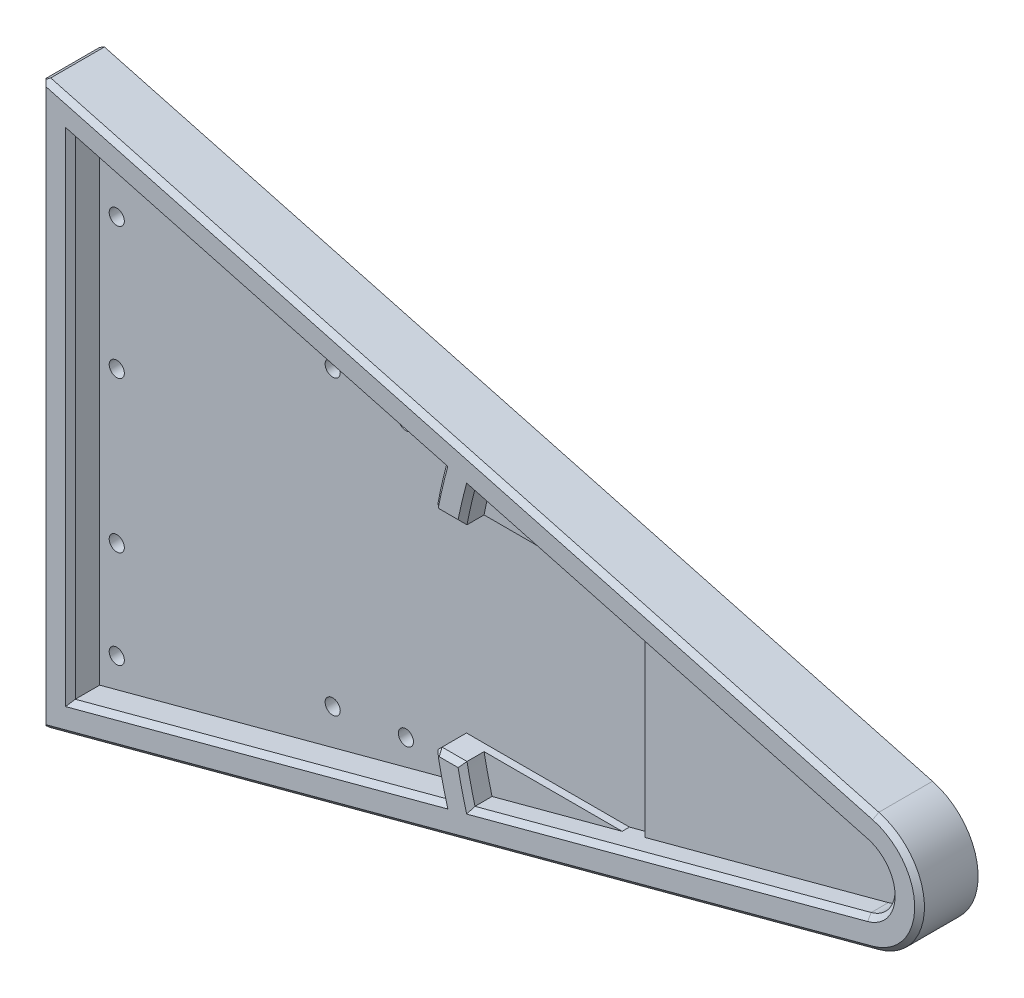
from build123d import *
from OCP.BRepFilletAPI import BRepFilletAPI_MakeChamfer

# Parameters (mm, degrees)
BOSS_EXTRUDE1_DEPTH     = 6
BOSS_EXTRUDE2_START     = 6
BOSS_EXTRUDE2_DEPTH     = 6
BOSS_EXTRUDE3_DEPTH     = 1.5
CUT_EXTRUDE3_DEPTH      = 6
CHAMFER1_SIZE           = 0.858848527
CHAMFER1_SIZE_2         = 1
CHAMFER2_SIZE           = 1
CHAMFER3_SIZE           = 1
CHAMFER3_SIZE2          = 0.816496581
CUT_EXTRUDE4_DEPTH      = 3
CHAMFER4_SIZE           = 1
CUT_EXTRUDE5_DEPTH      = 178.282114668
CUT_EXTRUDE5_DEPTH_BACK = 178.282114668
SKETCH8_R               = 1.55


with BuildPart() as part:
    # Sketch3 → Boss-Extrude1 (new body)
    with BuildSketch(Plane.XY):
        with BuildLine():
            Line((3.263957589, 12.181255556), (-167.389036276, 57.907587448))
            Line((-167.389036276, 57.907587448), (-167.389036276, -57.907587448))
            Line((-167.389036276, -57.907587448), (-83.597968128, -35.455838404))
            Line((-83.597968128, -35.455838404), (3.263957589, -12.181255556))
            ThreePointArc((3.263957589, -12.181255556), (12.610963724, 0), (3.263957589, 12.181255556))
        make_face()
    extrude(amount=BOSS_EXTRUDE1_DEPTH)

    # Sketch3<3> → Boss-Extrude2 (add)
    with BuildSketch(Plane.XY.offset(BOSS_EXTRUDE2_START)):
        with BuildLine():
            ThreePointArc((3.263957589, -12.181255556), (12.610963724, 0), (3.263957589, 12.181255556))
            Line((3.263957589, 12.181255556), (-167.389036276, 57.907587448))
            Line((-167.389036276, 57.907587448), (-167.389036276, -57.907587448))
            Line((-167.389036276, -57.907587448), (-83.597968128, -35.455838404))
            Line((-83.597968128, -35.455838404), (3.263957589, -12.181255556))
        make_face()
        with BuildLine():
            Line((1.711043318, -6.385700598), (-79.486479098, -28.142511157))
            ThreePointArc((-79.486479098, -28.142511157), (-83.143036276, 0), (-79.486479098, 28.142511157))
            Line((-79.486479098, 28.142511157), (1.711043318, 6.385700598))
            ThreePointArc((1.711043318, 6.385700598), (6.610963724, 0), (1.711043318, -6.385700598))
        make_face(mode=Mode.SUBTRACT)
        with BuildLine():
            Line((-85.282065581, -29.695433875), (-161.389036276, -50.088235211))
            Line((-161.389036276, -50.088235211), (-161.389036276, 50.088235211))
            Line((-161.389036276, 50.088235211), (-85.282065581, 29.695433875))
            ThreePointArc((-85.282065581, 29.695433875), (-89.143036276, 0), (-85.282065581, -29.695433875))
        make_face(mode=Mode.SUBTRACT)
    extrude(amount=BOSS_EXTRUDE2_DEPTH)

    # Sketch4 → Boss-Extrude3 (add)
    with BuildSketch(Plane.XY.offset(6)):
        with BuildLine():
            ThreePointArc((-79.486479098, 28.142511157), (-80.363791639, 24.584864194), (-81.12226241, 21))
            Line((-81.12226241, 21), (-52.830264568, 21))
            Line((-52.830264568, 21), (-79.486479098, 28.142511157))
        make_face()
        with BuildLine():
            Line((-79.486479098, -28.142511157), (-52.830264568, -21))
            Line((-52.830264568, -21), (-81.12226241, -21))
            ThreePointArc((-81.12226241, -21), (-80.363791639, -24.584864194), (-79.486479098, -28.142511157))
        make_face()
        with BuildLine():
            Line((-48.09821376, 19.732050808), (-48.09821376, -19.732050808))
            Line((-48.09821376, -19.732050808), (1.711043318, -6.385700598))
            ThreePointArc((1.711043318, -6.385700598), (6.610963724, 0), (1.711043318, 6.385700598))
            Line((1.711043318, 6.385700598), (-48.09821376, 19.732050808))
        make_face()
    extrude(amount=BOSS_EXTRUDE3_DEPTH)

    # Sketch5 → Cut-Extrude3 (cut)
    with BuildSketch(Plane.XY.offset(6)):
        with BuildLine():
            Line((-81.12226241, 21), (-87.228470489, 21))
            ThreePointArc((-87.228470489, 21), (-89.143036276, 0), (-87.228470489, -21))
            Line((-87.228470489, -21), (-81.12226241, -21))
            ThreePointArc((-81.12226241, -21), (-83.143036276, 0), (-81.12226241, 21))
        make_face()
    extrude(amount=CUT_EXTRUDE3_DEPTH, mode=Mode.SUBTRACT)

    # Chamfer1
    # the kernel refuses this chamfer: 1, 0.858848527 mm, written as the material it takes off along each edge
    with BuildSketch(Plane(origin=(-87.228470489, 21, 6), x_dir=(0.1850514416549976, 0.9827288354075131, 0), z_dir=(0, 0, 1))) as chamfer1_piece_1:
        with BuildLine():
            Line((0.995740125, 0), (CHAMFER1_SIZE * 0.185051441724, -CHAMFER1_SIZE * 0.982728835776))
            Line((CHAMFER1_SIZE * 0.185051441724, -CHAMFER1_SIZE * 0.982728835776), (0, 0))
            ThreePointArc((0, 0), (0.511949844, 0.001066408), (0.995740125, 0))
        make_face()
    extrude(amount=8.560742024, mode=Mode.SUBTRACT)
    with BuildSketch(Plane(origin=(-87.228470489, -21, 6), x_dir=(1, 0, 0), z_dir=(0, 0, 1))) as chamfer1_piece_2:
        with BuildLine():
            Line((CHAMFER1_SIZE_2, 0), (0.158025015, -0.841974985))
            ThreePointArc((0.158025015, -0.841974985), (0.080319075, -0.432228603), (0, 0))
            Line((0, 0), (CHAMFER1_SIZE_2, 0))
        make_face()
    extrude(amount=8.571682988, mode=Mode.SUBTRACT)

    # Chamfer2
    chamfer2_edges = [part.edges().sort_by_distance(p)[0] for p in [
        (-86.244364999, -25.784214234, 12),
        (-83.67536645, -21, 12),
        (-86.706914653, 21.489271267, 12),
        (-86.649457982, -21.420987493, 12),
        (-82.062539343, -35.044421502, 12),
        (12.610963724, 0, 12),
        (-161.389036276, 0, 12),
        (-86.228906055, 25.852006602, 12),
        (-123.335550929, -39.891834543, 12),
        (-38.88771789, 17.264105877, 12),
        (-38.88771789, -17.264105877, 12),
        (-82.062539343, 35.044421502, 12),
        (-167.389036276, 0, 12),
        (-123.335550929, 39.891834543, 12),
        (6.610963724, 0, 12),
        (-80.363791639, 24.584864194, 12),
        (-80.363791639, -24.584864194, 12),
        (-83.745942186, 21, 12),
    ]]
    chamfer(chamfer2_edges, length=CHAMFER2_SIZE)

    # Chamfer3: one chamfer whose edges measure the first distance from different faces: ONE call of the kernel's chamfer builder (chamfer() names one face for all edges)
    chamfer3_edges_1 = [part.edges().sort_by_distance(p)[0] for p in [
        (-167.389036276, -57.907587448, 5.5),
    ]]
    chamfer3_side_1 = [part.faces().sort_by_distance(p)[0] for p in [
        (-167.389036276, 0, 5.5),
    ]]
    chamfer3_edges_2 = [part.edges().sort_by_distance(p)[0] for p in [
        (-167.389036276, 57.907587448, 5.5),
    ]]
    chamfer3_side_2 = [part.faces().sort_by_distance(p)[0] for p in [
        (-82.062539343, 35.044421502, 5.5),
    ]]
    chamfer3 = BRepFilletAPI_MakeChamfer(part.part.solid().wrapped)
    for e in chamfer3_edges_1:
        chamfer3.Add(CHAMFER3_SIZE, CHAMFER3_SIZE2, e.wrapped, chamfer3_side_1[0].wrapped)  # the first distance lies on this face
    for e in chamfer3_edges_2:
        chamfer3.Add(CHAMFER3_SIZE, CHAMFER3_SIZE2, e.wrapped, chamfer3_side_2[0].wrapped)  # the first distance lies on this face
    add(Compound.cast(chamfer3.Shape()), mode=Mode.REPLACE)

    # Sketch7 → Cut-Extrude4 (cut)
    with BuildSketch(Plane(origin=(0, 0, 0), x_dir=(-1, 0, 0), z_dir=(0, 0, -1))):
        with BuildLine():
            Line((161.389036276, 50.088235211), (85.282065581, 29.695433875))
            ThreePointArc((85.282065581, 29.695433875), (89.143036276, 0), (85.282065581, -29.695433875))
            Line((85.282065581, -29.695433875), (161.389036276, -50.088235211))
            Line((161.389036276, -50.088235211), (161.389036276, 50.088235211))
        make_face()
    extrude(amount=-CUT_EXTRUDE4_DEPTH, mode=Mode.SUBTRACT)

    # Chamfer4
    chamfer4_edges = [part.edges().sort_by_distance(p)[0] for p in [
        (-89.143036276, 0, 3),
        (-123.335550929, 39.891834543, 3),
        (-161.389036276, 0, 3),
        (-123.335550929, -39.891834543, 3),
    ]]
    chamfer(chamfer4_edges, length=CHAMFER4_SIZE)

    # Sketch8 → Cut-Extrude5 (cut, two sides: drawn at the far end of the back side and taken through both)
    with BuildSketch(Plane(origin=(0, 0, 3), x_dir=(-1, 0, 0), z_dir=(0, 0, -1)).offset(-CUT_EXTRUDE5_DEPTH_BACK)):
        with Locations((157.889036276, 34.775263876)):
            Circle(SKETCH8_R)
        with Locations((157.889036276, 7.775263876)):
            Circle(SKETCH8_R)
        with Locations((157.889036276, -23.157763876)):
            Circle(SKETCH8_R)
        with Locations((157.889036276, -43.157763876)):
            Circle(SKETCH8_R)
        with Locations((98.643036276, 28)):
            Circle(SKETCH8_R)
        with Locations((113.643036276, 30)):
            Circle(SKETCH8_R)
        with Locations((98.643036276, -28)):
            Circle(SKETCH8_R)
        with Locations((113.643036276, -30)):
            Circle(SKETCH8_R)
    extrude(amount=CUT_EXTRUDE5_DEPTH + CUT_EXTRUDE5_DEPTH_BACK, mode=Mode.SUBTRACT)


solid = part.part
